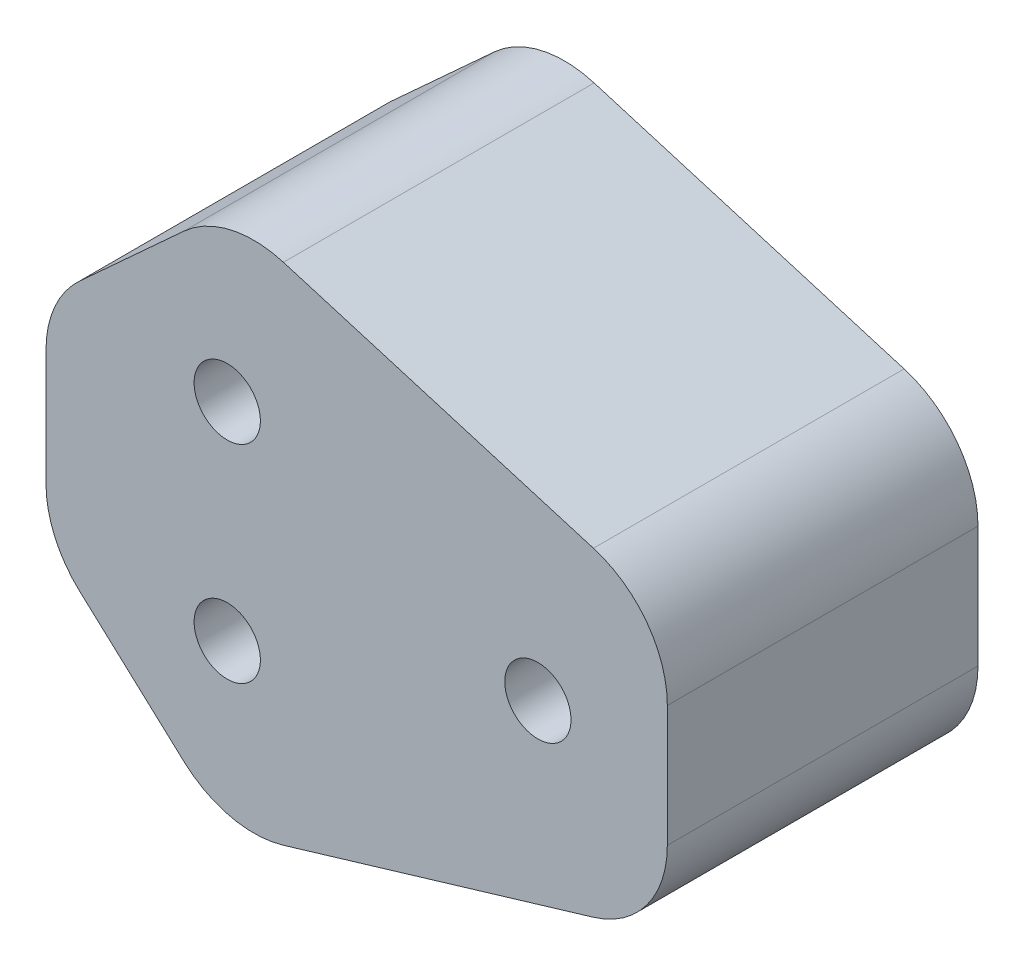
from build123d import *

# Parameters (mm, degrees)
SKETCH1_R           = 2.032
BOSS_EXTRUDE1_DEPTH = 19.05
FILLET1_R           = 6.35


with BuildPart() as part:
    # Sketch1 → Boss-Extrude1 (new body)
    with BuildSketch(Plane.XY):
        Polygon((0, 12.7), (0, 0), (11.1125, -10.16), (38.1, -2.094157315), (38.1, 14.794157315), (11.1125, 22.86), align=None)
        with Locations((11.1125, 0)):
            Circle(SKETCH1_R, mode=Mode.SUBTRACT)
        with Locations((30.1625, 6.35)):
            Circle(SKETCH1_R, mode=Mode.SUBTRACT)
        with Locations((11.1125, 12.7)):
            Circle(SKETCH1_R, mode=Mode.SUBTRACT)
    extrude(amount=BOSS_EXTRUDE1_DEPTH)

    # Fillet1
    fillet1_edges = [part.edges().sort_by_distance(p)[0] for p in [
        (38.1, 14.794157315, 9.525),
        (11.1125, 22.86, 9.525),
        (0, 12.7, 9.525),
        (38.1, -2.094157315, 9.525),
        (11.1125, -10.16, 9.525),
        (0, 0, 9.525),
    ]]
    fillet(fillet1_edges, radius=FILLET1_R)


solid = part.part
